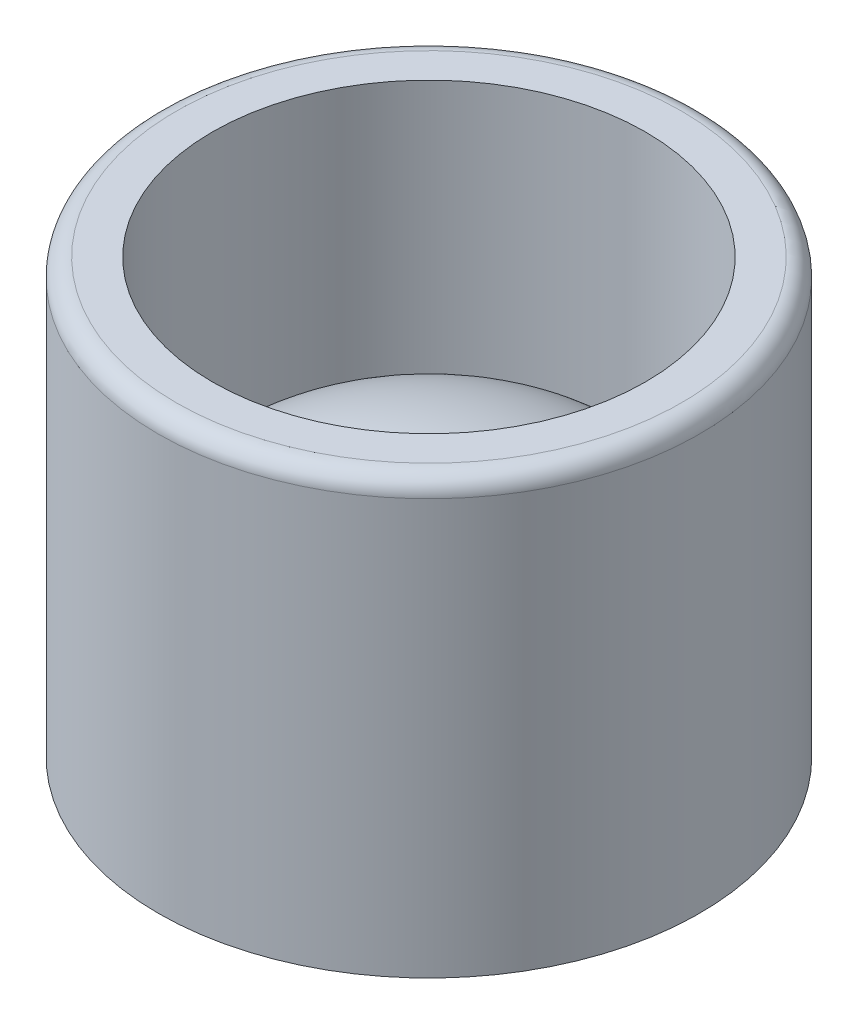
from build123d import *

# Parameters (mm, degrees)
SKETCH2_R           = 7.5
BOSS_EXTRUDE1_DEPTH = 12
SKETCH3_R           = 6
CUT_EXTRUDE1_DEPTH  = 8
DOME1_FACE_RADIUS   = 6
DOME1_HEIGHT        = 3
FILLET1_R           = 0.5


with BuildPart() as part:
    # Sketch2 → Boss-Extrude1 (new body)
    with BuildSketch(Plane(origin=(0, 0, 0), x_dir=(1, 0, 0), z_dir=(0, 1, 0))):
        Circle(SKETCH2_R)
    extrude(amount=BOSS_EXTRUDE1_DEPTH)

    # Sketch3 → Cut-Extrude1 (cut)
    with BuildSketch(Plane(origin=(0, 12, 0), x_dir=(1, 0, 0), z_dir=(0, 1, 0))):
        Circle(SKETCH3_R)
    extrude(amount=-CUT_EXTRUDE1_DEPTH, mode=Mode.SUBTRACT)

    # Dome1: an elliptical dome of height H over a round flat face of radius A is half a spheroid: the quarter ellipse of half axes A and H revolved about the face's axis
    with BuildSketch(Plane((0, 4, 0), x_dir=(0, 0, -1), z_dir=(1, 0, 0)), mode=Mode.PRIVATE) as dome1_quarter:
        Ellipse(DOME1_FACE_RADIUS, DOME1_HEIGHT)
        Rectangle(DOME1_FACE_RADIUS, DOME1_HEIGHT, align=(Align.MIN, Align.MIN), mode=Mode.INTERSECT)
    revolve(dome1_quarter.sketch, axis=Axis((0, 4, 0), (0, 1, 0)))

    # Fillet1
    fillet1_edges = [part.edges().sort_by_distance(p)[0] for p in [
        (-7.5, 12, 0),
    ]]
    fillet(fillet1_edges, radius=FILLET1_R)


solid = part.part
